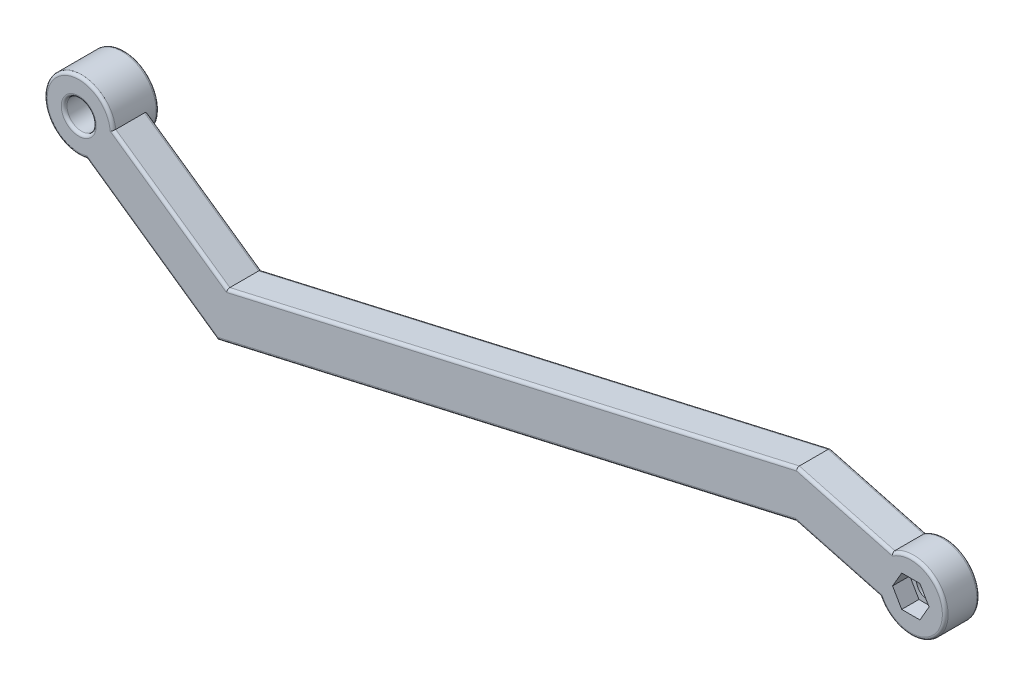
from build123d import *

# Parameters (mm, degrees)
SKETCH_1_R          = 2.5499999999999923
SKETCH_1_R_2        = 2.05
EXTRUDE_1_DEPTH     = 3
SKETCH_2_R          = 6.000000000000016
SKETCH_2_R_2        = 2.5499999999999923
EXTRUDE_2_DEPTH     = 2
CUT_EXTRUDE_1_DEPTH = 3
FILLET_1_R          = 0.5


with BuildPart() as part:
    # 草图1 → 凸台-拉伸1 (new, symmetric)
    with BuildSketch(Plane.XY):
        with BuildLine():
            ThreePointArc((-139.0423349447196, 0.7114963732099342), (-149.91491226573402, 3.4414586181062896), (-143.63094643552796, -5.841719981102021))
            Line((-143.63094643552793, -5.841719981101994), (-120.83961538856128, -21.80038178602087))
            Line((-120.83961538856128, -21.80038178602087), (-20.07628512486292, 1.238319664583507))
            Line((-20.076285124862924, 1.238319664583508), (-5.3550277980200836, -2.706229347714671))
            ThreePointArc((-5.355027798020084, -2.706229347714672), (5.795554957734421, -1.552914270615085), (-3.284475437199971, 5.0211772625978925))
            Line((-3.284475437199972, 5.021177262597891), (-19.923714875137087, 9.479648032661107))
            Line((-19.923714875137087, 9.479648032661107), (-119.16038461143873, -13.20999512446421))
            Line((-119.16038461143873, -13.209995124464209), (-139.0423349447196, 0.7114963732099535))
        make_face()
        with Locations((-145, 0)):
            Circle(SKETCH_1_R, mode=Mode.SUBTRACT)
        Circle(SKETCH_1_R_2, mode=Mode.SUBTRACT)
    extrude(amount=EXTRUDE_1_DEPTH, both=True)

    # 草图2 → 凸台-拉伸2 (add)
    with BuildSketch(Plane.XY.offset(-3)):
        with Locations((-145, 0)):
            Circle(SKETCH_2_R)
        with Locations((-145, 0)):
            Circle(SKETCH_2_R_2, mode=Mode.SUBTRACT)
    extrude(amount=-EXTRUDE_2_DEPTH)

    # 草图3 → 切除-拉伸1 (cut)
    with BuildSketch(Plane.XY.offset(3)):
        Polygon((1.58771324027147, -2.749999999999999), (3.1754264805429413, 4.8e-16), (1.5877132402714713, 2.75), (-1.58771324027147, 2.75), (-3.1754264805429413, 1.25e-15), (-1.5877132402714713, -2.749999999999999), align=None)
    extrude(amount=-CUT_EXTRUDE_1_DEPTH, mode=Mode.SUBTRACT)

    # 圆角1
    fillet_1_edges = [part.edges().sort_by_distance(p)[0] for p in [
        (-12.715656461441505, -0.7339548415655814, -3),
        (-132.2352809120446, -13.821050883561433, -3),
        (-70.45795025671211, -10.281031060718682, -3),
        (-69.54204974328792, -1.865173545901552, 3),
        (-129.10135977807917, -6.2492493756271275, 3),
        (-132.2352809120446, -13.821050883561433, 3),
        (-151.00000000000003, 7.3e-16, -5),
        (-129.10135977807917, -6.2492493756271275, -3),
        (-69.54204974328792, -1.865173545901552, -3),
        (5.795554957734422, -1.5529142706150816, -3),
        (-11.60409515616853, 7.250412647629499, -3),
        (-11.60409515616853, 7.250412647629499, 3),
        (5.795554957734422, -1.5529142706150816, 3),
        (-12.715656461441505, -0.7339548415655814, 3),
        (-70.45795025671211, -10.281031060718682, 3),
        (-2.05, 2.5e-16, -3),
        (-147.54999999999998, 3.1e-16, -5),
        (-147.54999999999998, 3.1e-16, 3),
        (-149.91491226573402, 3.4414586181062985, 3),
    ]]
    fillet(fillet_1_edges, radius=FILLET_1_R)


solid = part.part
